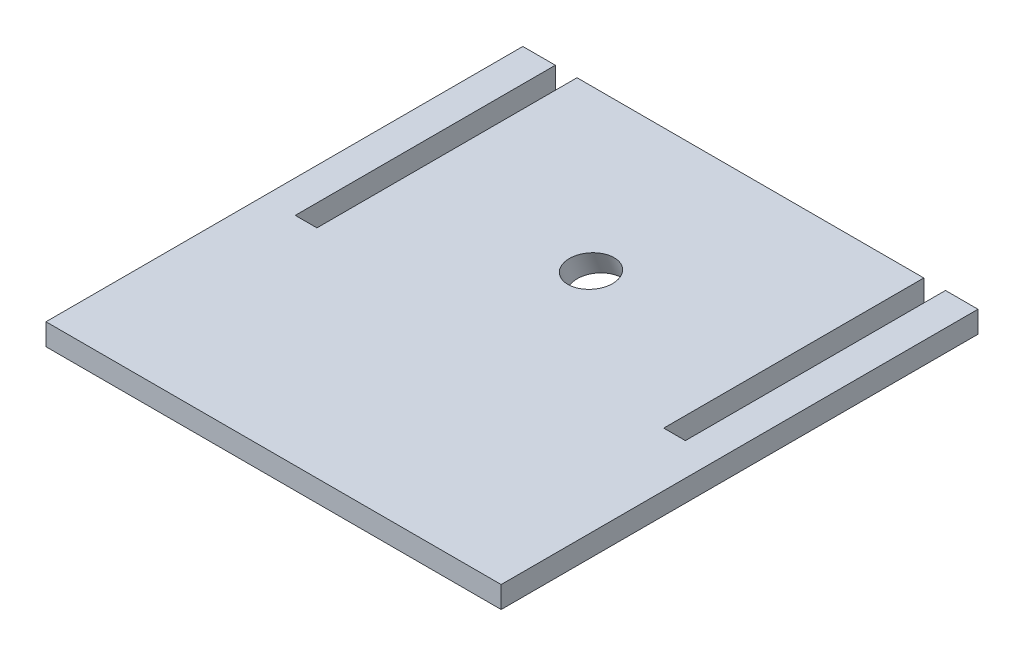
from build123d import *

# Parameters (mm, degrees)
SKETCH1_W           = 330.2
SKETCH1_H           = 279.4
BOSS_EXTRUDE1_DEPTH = 6.35
SKETCH2_W           = 12.7
SKETCH2_H           = 152.4
CUT_EXTRUDE1_DEPTH  = 217.645770787
SKETCH4_W           = 31.75
SKETCH4_H           = 279.4
CUT_EXTRUDE3_DEPTH  = 217.645770787
CAVITY1_START       = -28.48121296
CAVITY1_OUTLINE_R   = 12.7
CAVITY1_DEPTH       = 23.121998378


# Read off the part's stored shape, not the designer's step: Cavity1
with BuildPart() as part:
    # Sketch1 → Boss-Extrude1 (new, symmetric)
    with BuildSketch(Plane(origin=(0, 0, 0), x_dir=(1, 0, 0), z_dir=(0, 1, 0))):
        Rectangle(SKETCH1_W, SKETCH1_H)
    extrude(amount=BOSS_EXTRUDE1_DEPTH, both=True)

    # Sketch2 → Cut-Extrude1 (cut, through all)
    with BuildSketch(Plane(origin=(0, 6.35, 0), x_dir=(1, 0, 0), z_dir=(0, 1, 0))):
        with Locations((-107.95, 63.5)):
            Rectangle(SKETCH2_W, SKETCH2_H)
        with Locations((107.95, 63.5)):
            Rectangle(SKETCH2_W, SKETCH2_H)
    extrude(amount=-CUT_EXTRUDE1_DEPTH, mode=Mode.SUBTRACT)

    # Sketch4 → Cut-Extrude3 (cut, through all)
    with BuildSketch(Plane(origin=(0, 6.35, 0), x_dir=(1, 0, 0), z_dir=(0, 1, 0))):
        with Locations((-149.225, 0)):
            Rectangle(SKETCH4_W, SKETCH4_H)
        with Locations((149.225, 0)):
            Rectangle(SKETCH4_W, SKETCH4_H)
    extrude(amount=-CUT_EXTRUDE3_DEPTH, mode=Mode.SUBTRACT)

    # Cavity1 outline → Cavity1 (cut)
    with BuildSketch(Plane(origin=(0, 0, 0), x_dir=(0.999972352848875, -0.006960139267425278, -0.0026172503248496305), z_dir=(0.007435962471992497, 0.9359846644758757, 0.3519622342355749)).offset(CAVITY1_START)):
        with Locations((0.653273782, 45.008151356)):
            Circle(CAVITY1_OUTLINE_R)
    extrude(amount=CAVITY1_DEPTH, mode=Mode.SUBTRACT)


solid = part.part
